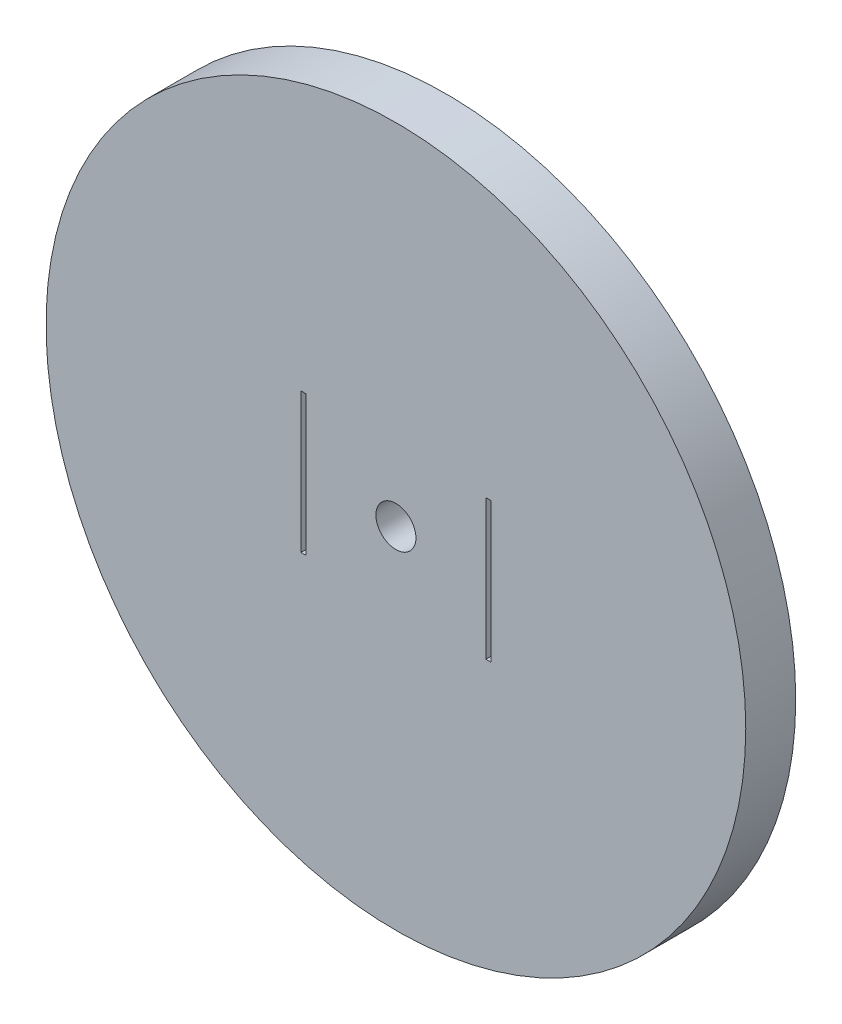
from build123d import *

# Parameters (mm, degrees)
SKETCH1_R           = 35
SKETCH1_R_2         = 2
SKETCH1_W           = 0.5
SKETCH1_H           = 14
BOSS_EXTRUDE1_DEPTH = 5


with BuildPart() as part:
    # Sketch1 → Boss-Extrude1 (new body)
    with BuildSketch(Plane.XY):
        Circle(SKETCH1_R)
        Circle(SKETCH1_R_2, mode=Mode.SUBTRACT)
        with Locations((-9.25, 0)):
            Rectangle(SKETCH1_W, SKETCH1_H, mode=Mode.SUBTRACT)
        with Locations((9.25, 0)):
            Rectangle(SKETCH1_W, SKETCH1_H, mode=Mode.SUBTRACT)
    extrude(amount=BOSS_EXTRUDE1_DEPTH)

    # Sketch3 → Revolve1 (revolve)
    with BuildSketch(Plane(origin=(0, 0, 0), x_dir=(1, 0, 0), z_dir=(0, 1, 0))):
        with BuildLine():
            Line((-24.35, 14.632072887), (-24.35, 0))
            Line((-24.35, 0), (-20, 0))
            Line((-20, 0), (-20, 18.982072887))
            ThreePointArc((-20, 18.982072887), (-23.075914498, 17.707987385), (-24.35, 14.632072887))
        make_face()
    revolve(axis=Axis((-20, 0, -14.632072887), (0, 0, 1)))


solid = part.part
